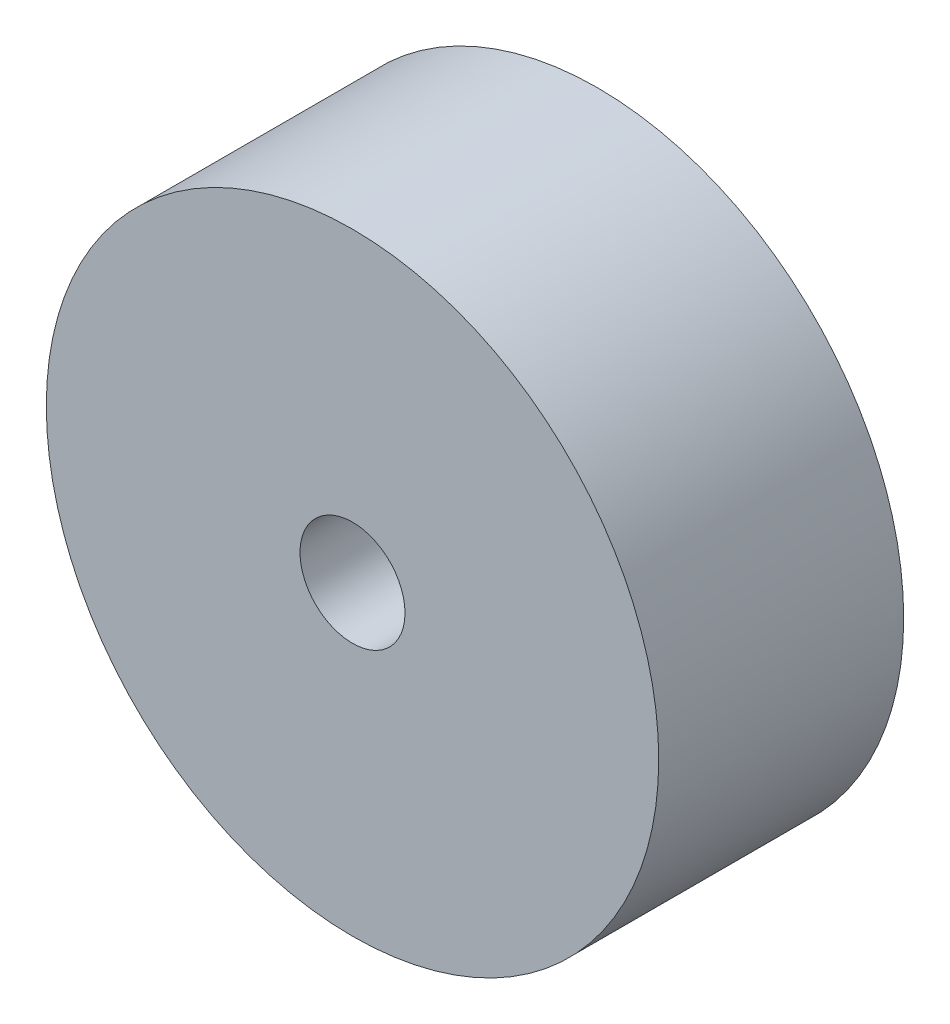
from build123d import *

# Parameters (mm, degrees)
SKETCH1_R           = 2.2225
SKETCH1_R_2         = 0.381
BOSS_EXTRUDE1_DEPTH = 1.778


with BuildPart() as part:
    # Sketch1 → Boss-Extrude1 (new body)
    with BuildSketch(Plane.XY):
        Circle(SKETCH1_R)
        Circle(SKETCH1_R_2, mode=Mode.SUBTRACT)
    extrude(amount=BOSS_EXTRUDE1_DEPTH)


solid = part.part
